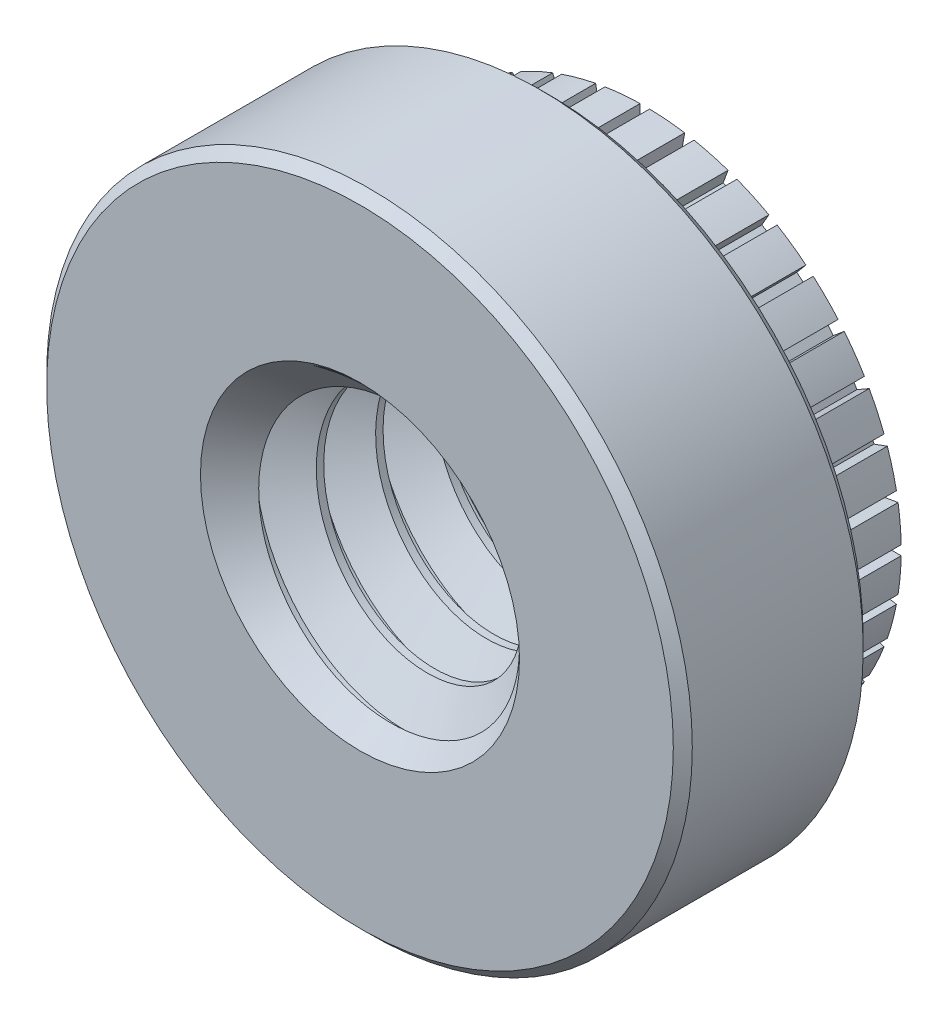
from build123d import *

# Parameters (mm, degrees)
SKETCH1_R               = 4.318
EXTRUDE1_DEPTH          = 2.54
SKETCH2_R               = 3.429
EXTRUDE2_DEPTH          = 1.524
SKETCH3_W               = 0.127
SKETCH3_H               = 1.0795
CUT_EXTRUDE_THIN1_DEPTH = 1.524
CIRPATTERN1_COUNT       = 36
SKETCH5_OUTSIDE_W       = 13.21
SKETCH5_OUTSIDE_H       = 13.21
SKETCH5_OUTSIDE_R       = 2.9845
CUT_EXTRUDE1_DEPTH      = 0.254
CHAMFER1_SIZE           = 0.127
SKETCH6_R               = 4.318
SKETCH6_R_2             = 2.9845
CUT_EXTRUDE2_DEPTH      = 0.127
CHAMFER2_SIZE           = 0.127
SKETCH7_R               = 2.0828
CUT_EXTRUDE3_DEPTH      = 8.335280772
SWEEP1_PITCH            = 0.79375
SKETCH10_R              = 4.191
CUT_EXTRUDE4_DEPTH      = 8.741803216
SKETCH11_R              = 2.8575
CUT_EXTRUDE5_DEPTH      = 8.335280827


with BuildPart() as part:
    # Sketch1 → Extrude1 (new body)
    with BuildSketch(Plane.XY):
        Circle(SKETCH1_R)
    extrude(amount=-EXTRUDE1_DEPTH)

    # Sketch2 → Extrude2 (add)
    with BuildSketch(Plane(origin=(0, 0, -2.54), x_dir=(-1, 0, 0), z_dir=(0, 0, -1))):
        with Locations(Location((0, 0, 0), (0, 0, 180))):
            Circle(SKETCH2_R)
    extrude(amount=EXTRUDE2_DEPTH)

    # Sketch3 → Cut-Extrude-Thin1 (cut)
    with BuildSketch(Plane(origin=(0, 0, -4.064), x_dir=(-1, 0, 0), z_dir=(0, 0, -1))):
        with Locations((0, 3.77825)):
            Rectangle(SKETCH3_W, SKETCH3_H)
    cut_extrude_thin1 = extrude(amount=-CUT_EXTRUDE_THIN1_DEPTH, mode=Mode.SUBTRACT)

    # CirPattern1: Cut-Extrude-Thin1 ×36 about axis
    cirpattern1_axis = Axis((0, 0, 0), (0, 0, 1))
    for i in range(1, CIRPATTERN1_COUNT):
        add(cut_extrude_thin1.rotate(cirpattern1_axis, i * 360 / CIRPATTERN1_COUNT), mode=Mode.SUBTRACT)

    # Sketch5 outside → Cut-Extrude1 (cut)
    with BuildSketch(Plane(origin=(0, 0, -4.064), x_dir=(-1, 0, 0), z_dir=(0, 0, -1))):
        Rectangle(SKETCH5_OUTSIDE_W, SKETCH5_OUTSIDE_H)
        Circle(SKETCH5_OUTSIDE_R, mode=Mode.SUBTRACT)
    extrude(amount=-CUT_EXTRUDE1_DEPTH, mode=Mode.SUBTRACT)

    # Chamfer1
    chamfer1_edges = [part.edges().sort_by_distance(p)[0] for p in [
        (2.9845, 0, -4.064),
    ]]
    chamfer(chamfer1_edges, length=CHAMFER1_SIZE)

    # Sketch6 → Cut-Extrude2 (cut)
    with BuildSketch(Plane(origin=(0, 0, -2.54), x_dir=(-1, 0, 0), z_dir=(0, 0, -1))):
        with Locations(Location((0, 0, 0), (0, 0, 180))):
            Circle(SKETCH6_R)
        Circle(SKETCH6_R_2, mode=Mode.SUBTRACT)
    extrude(amount=CUT_EXTRUDE2_DEPTH, mode=Mode.SUBTRACT)

    # Chamfer2
    chamfer2_edges = [part.edges().sort_by_distance(p)[0] for p in [
        (-4.318, 0, 0),
        (-4.318, 0, -2.54),
    ]]
    chamfer(chamfer2_edges, length=CHAMFER2_SIZE)

    # Sketch7 → Cut-Extrude3 (cut, through all)
    with BuildSketch(Plane.XY):
        Circle(SKETCH7_R)
    extrude(amount=-CUT_EXTRUDE3_DEPTH, mode=Mode.SUBTRACT)

    # Sweep1: arcs per turn and ends read off the stored shape
    # Sweep1: the profile of Sketch9 profile screwed along a right-hand helix through 8 turns, 6 arcs to a turn; built about Z, then put on its axis
    sweep1_z = Axis((0, 0, 0), (0, 0, 1))
    sweep1_corners = [(2.0831, 0, -0.694704455), (1.567244252, 0, -0.396875), (1.567244252, 0, -0.29765625), (2.0831, 0, 0.000173205)]
    with BuildLine(mode=Mode.PRIVATE) as sweep1_profile:
        Line(sweep1_corners[0], sweep1_corners[1])
        Line(sweep1_corners[1], sweep1_corners[2])
        Line(sweep1_corners[2], sweep1_corners[3])
        Line(sweep1_corners[3], sweep1_corners[0])
    sweep1_cap = Face(sweep1_profile.wire())
    sweep1_turn_angles = [0, 30, 60, 90, 120, 150, 180, 210, 240, 270, 300, 330, 360]
    sweep1_turn_weights = [1, 0.8660254037844387, 1, 0.8660254037844387, 1, 0.8660254037844387, 1, 0.8660254037844387, 1, 0.8660254037844387, 1, 0.8660254037844387, 1]
    sweep1_turn_rails = [Edge.make_bspline([Vector(p[0], p[1], 0).rotate(sweep1_z, sweep1_turn_angles[k]) / sweep1_turn_weights[k] + Vector(0, 0, p[2] + SWEEP1_PITCH * sweep1_turn_angles[k] / 360) for k in range(13)], [0, 0, 0, 1, 1, 2, 2, 3, 3, 4, 4, 5, 5, 6, 6, 6], 2, sweep1_turn_weights) for p in sweep1_corners]
    sweep1_turn_sides = [Face.make_surface_from_curves(sweep1_turn_rails[p[0]], sweep1_turn_rails[p[1]]) for p in [(0, 1), (1, 2), (2, 3), (3, 0)]]
    sweep1_turn = Solid(Shell([*sweep1_turn_sides, sweep1_cap, sweep1_cap.rotate(sweep1_z, 360).moved(Location((0, 0, SWEEP1_PITCH * 360 / 360)))]))
    sweep1_each = [*[sweep1_turn.moved(Location((0, 0, SWEEP1_PITCH * i))) for i in range(8)]]
    add(Plane(origin=(0, 0, -4.064), x_dir=(0, 1, 0), z_dir=(0, 0, 1)) * Compound([sweep1_each[i] for i in range(0, 8, 2)]))
    add(Plane(origin=(0, 0, -4.064), x_dir=(0, 1, 0), z_dir=(0, 0, 1)) * Compound([sweep1_each[i] for i in range(1, 8, 2)]))

    # Sketch10 → Cut-Extrude4 (cut, through all)
    with BuildSketch(Plane.XY):
        Circle(SKETCH10_R)
    extrude(amount=CUT_EXTRUDE4_DEPTH, mode=Mode.SUBTRACT)

    # Sketch11 → Cut-Extrude5 (cut, through all)
    with BuildSketch(Plane(origin=(0, 0, -4.064), x_dir=(-1, 0, 0), z_dir=(0, 0, -1))):
        Circle(SKETCH11_R)
    extrude(amount=CUT_EXTRUDE5_DEPTH, mode=Mode.SUBTRACT)

    # Cut-Extrude6 cone 1 section (through the dimple's axis) → Cut-Extrude6 (revolve, cut)
    with BuildSketch(Plane(origin=(0, 0, 0), x_dir=(0, -1, 0), z_dir=(1, 0, 0))):
        Polygon((0, 0), (2.1336, 0), (0, 2.1336), align=None)
    revolve(axis=Axis((0, 0, 0), (0, 0, -1)), mode=Mode.SUBTRACT)

    # Cut-Extrude7 cone 1 section (through the dimple's axis) → Cut-Extrude7 (revolve, cut)
    with BuildSketch(Plane(origin=(0, 0, -4.064), x_dir=(0, 1, 0), z_dir=(1, 0, 0))):
        Polygon((0, 0), (2.1336, 0), (0, 2.1336), align=None)
    revolve(axis=Axis((0, 0, -4.064), (0, 0, 1)), mode=Mode.SUBTRACT)


solid = part.part
